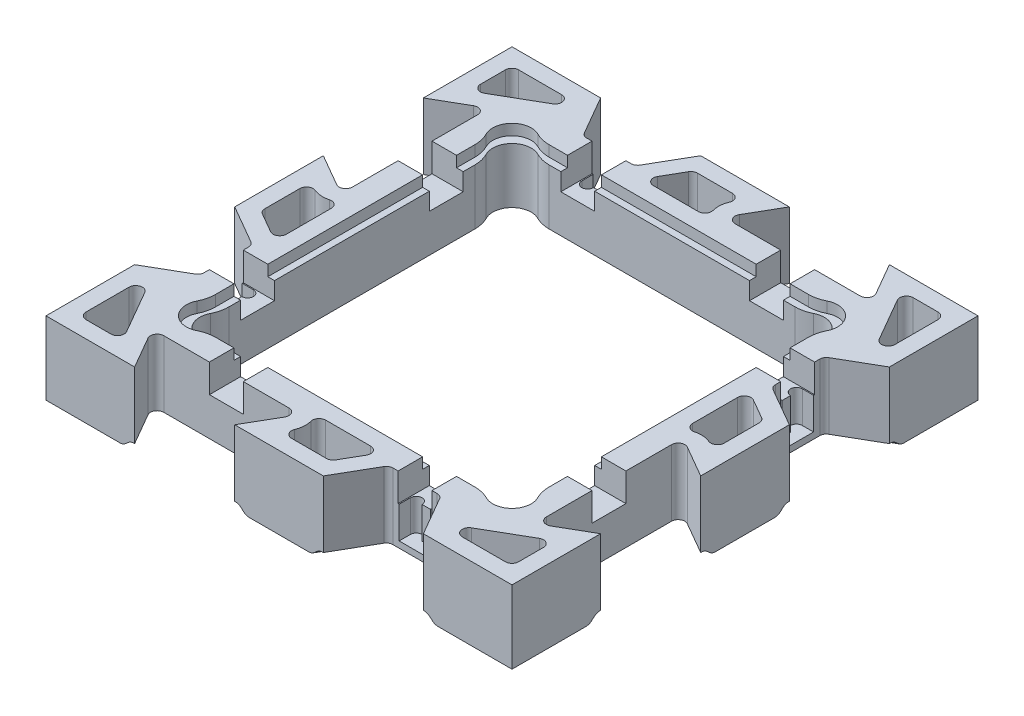
from build123d import *

# Parameters (mm, degrees)
SKETCH1_W                               = 139.7
SKETCH1_H                               = 139.7
BOSS_EXTRUDE1_DEPTH                     = 10.95
POWER_SUPPLY_COMPONENT_DEPTH_DEPTH      = 102.181297679
POWER_SUPPLY_COMPONENT_DEPTH_DEPTH_BACK = 102.181297679
CUT_EXTRUDE6_DEPTH                      = 22.4
SKETCH8_W                               = 10.16
SKETCH8_H                               = 9.35
CUT_EXTRUDE7_DEPTH                      = 8.48
CUT_EXTRUDE8_DEPTH                      = 9.53
FILLET2_R                               = 2
CIRPATTERN5_COUNT                       = 4
FILLET2_OF_CIRPATTERN5_R                = 2
CUT_EXTRUDE9_DEPTH                      = 3.25
FILLET3_R                               = 10
CIRPATTERN6_COUNT                       = 4
FILLET4_R                               = 2
CUT_EXTRUDE10_DEPTH                     = 16.9
FILLET5_R                               = 2
CIRPATTERN7_COUNT                       = 4
FILLET5_OF_CIRPATTERN7_R                = 2


with BuildPart() as part:
    # Sketch1 → Boss-Extrude1 (new, symmetric)
    with BuildSketch(Plane(origin=(0, 0, 0), x_dir=(1, 0, 0), z_dir=(0, 1, 0))):
        Rectangle(SKETCH1_W, SKETCH1_H)
    extrude(amount=BOSS_EXTRUDE1_DEPTH, both=True)

    # Sketch6 → power_supply_component_depth (cut, two sides: drawn at the far end of the back side and taken through both)
    with BuildSketch(Plane(origin=(0, 10.95, 0), x_dir=(1, 0, 0), z_dir=(0, 1, 0)).offset(-POWER_SUPPLY_COMPONENT_DEPTH_DEPTH_BACK)):
        with BuildLine():
            Line((-48, 39.868272016), (-48, -39.868272016))
            ThreePointArc((-48, -39.868272016), (-48, -48), (-39.868272016, -48))
            Line((-39.868272016, -48), (39.868272016, -48))
            ThreePointArc((39.868272016, -48), (48, -48), (48, -39.868272016))
            Line((48, -39.868272016), (48, 39.868272016))
            ThreePointArc((48, 39.868272016), (48, 48), (39.868272016, 48))
            Line((39.868272016, 48), (-39.868272016, 48))
            ThreePointArc((-39.868272016, 48), (-48, 48), (-48, 39.868272016))
        make_face()
    extrude(amount=POWER_SUPPLY_COMPONENT_DEPTH_DEPTH + POWER_SUPPLY_COMPONENT_DEPTH_DEPTH_BACK, mode=Mode.SUBTRACT)

    # Sketch4 → Cut-Extrude6 (cut)
    with BuildSketch(Plane(origin=(0, 10.95, 0), x_dir=(1, 0, 0), z_dir=(0, 1, 0))):
        Polygon((-43.283333333, -69.85), (-50.500211698, -57.35), (-6.066454968, -57.35), (-13.283333333, -69.85), align=None)
        Polygon((43.283333333, -69.85), (36.066454968, -57.35), (20.500211698, -57.35), (13.283333333, -69.85), align=None)
    cut_extrude6 = extrude(amount=-CUT_EXTRUDE6_DEPTH, mode=Mode.SUBTRACT)

    # Sketch8 → Cut-Extrude7 (cut)
    with BuildSketch(Plane(origin=(0, 10.95, 0), x_dir=(1, 0, 0), z_dir=(0, 1, 0))):
        with Locations((-28.283333333, -52.675)):
            Rectangle(SKETCH8_W, SKETCH8_H)
        with Locations((28.283333333, -52.675)):
            Rectangle(SKETCH8_W, SKETCH8_H)
    cut_extrude7 = extrude(amount=-CUT_EXTRUDE7_DEPTH, mode=Mode.SUBTRACT)

    # Sketch9 → Cut-Extrude8 (cut)
    with BuildSketch(Plane(origin=(0, 2.47, 0), x_dir=(1, 0, 0), z_dir=(0, 1, 0))):
        with BuildLine():
            Line((27.018333333, -53.975), (29.548333333, -53.975))
            ThreePointArc((29.548333333, -53.975), (31.298333333, -52.225), (33.048333333, -53.975))
            Line((33.048333333, -53.975), (33.048333333, -57.35))
            Line((33.048333333, -57.35), (23.518333333, -57.35))
            Line((23.518333333, -57.35), (23.518333333, -53.975))
            ThreePointArc((23.518333333, -53.975), (25.268333333, -52.225), (27.018333333, -53.975))
        make_face()
    cut_extrude8 = extrude(amount=-CUT_EXTRUDE8_DEPTH, mode=Mode.SUBTRACT)

    # Fillet2
    fillet2_edges = [part.edges().sort_by_distance(p)[0] for p in [
        (-50.500211698, 0, 57.35),
        (-6.066454968, 0, 57.35),
        (20.500211698, 0, 57.35),
        (36.066454968, 0, 57.35),
    ]]
    fillet(fillet2_edges, radius=FILLET2_R)

    # CirPattern5: Cut-Extrude6, Cut-Extrude7, Cut-Extrude8 ×4 about axis
    cirpattern5_axis = Axis((0, 0, 0), (0, 1, 0))
    add([cut_extrude6.rotate(cirpattern5_axis, i * 360 / CIRPATTERN5_COUNT) for i in range(1, CIRPATTERN5_COUNT)], mode=Mode.SUBTRACT)
    add([cut_extrude7.rotate(cirpattern5_axis, i * 360 / CIRPATTERN5_COUNT) for i in range(1, CIRPATTERN5_COUNT)], mode=Mode.SUBTRACT)
    add([cut_extrude8.rotate(cirpattern5_axis, i * 360 / CIRPATTERN5_COUNT) for i in range(1, CIRPATTERN5_COUNT)], mode=Mode.SUBTRACT)

    # Fillet2 of CirPattern5
    fillet2_of_cirpattern5_edges = [part.edges().sort_by_distance(p)[0] for p in [
        (57.35, 0, 50.500211698),
        (57.35, 0, 6.066454968),
        (57.35, 0, -20.500211698),
        (57.35, 0, -36.066454968),
        (50.500211698, 0, -57.35),
        (6.066454968, 0, -57.35),
        (-20.500211698, 0, -57.35),
        (-36.066454968, 0, -57.35),
        (-57.35, 0, -50.500211698),
        (-57.35, 0, -6.066454968),
        (-57.35, 0, 20.500211698),
        (-57.35, 0, 36.066454968),
    ]]
    fillet(fillet2_of_cirpattern5_edges, radius=FILLET2_OF_CIRPATTERN5_R)

    # Sketch10 → Cut-Extrude9 (cut)
    with BuildSketch(Plane(origin=(0, 10.95, 0), x_dir=(1, 0, 0), z_dir=(0, 1, 0))):
        with BuildLine():
            Line((-41.868272016, 50), (41.868272016, 50))
            ThreePointArc((41.868272016, 50), (50, 50), (50, 41.868272016))
            Line((50, 41.868272016), (50, -41.868272016))
            ThreePointArc((50, -41.868272016), (50, -50), (41.868272016, -50))
            Line((41.868272016, -50), (-41.868272016, -50))
            ThreePointArc((-41.868272016, -50), (-50, -50), (-50, -41.868272016))
            Line((-50, -41.868272016), (-50, 41.868272016))
            ThreePointArc((-50, 41.868272016), (-50, 50), (-41.868272016, 50))
        make_face()
    extrude(amount=-CUT_EXTRUDE9_DEPTH, mode=Mode.SUBTRACT)

    # Fillet3
    fillet3_edges = [part.edges().sort_by_distance(p)[0] for p in [
        (-48, -1.625, -39.868272016),
        (-39.868272016, -1.625, -48),
        (39.868272016, -1.625, -48),
        (48, -1.625, -39.868272016),
        (48, -1.625, 39.868272016),
        (39.868272016, -1.625, 48),
        (-39.868272016, -1.625, 48),
        (-48, -1.625, 39.868272016),
        (41.868272016, 9.325, 50),
        (-50, 9.325, 41.868272016),
        (-41.868272016, 9.325, -50),
        (50, 9.325, -41.868272016),
        (41.868272016, 9.325, -50),
        (50, 9.325, 41.868272016),
        (-41.868272016, 9.325, 50),
        (-50, 9.325, -41.868272016),
    ]]
    fillet(fillet3_edges, radius=FILLET3_R)

    # Cut-Sweep1: sweep along a path in Sketch12
    with BuildLine(Plane.XZ.offset(10.95)) as cut_sweep1_path:
        Line((-13.283333333, 69.85), (-7.798505776, 60.35))
        ThreePointArc((-7.798505776, 60.35), (-7.798505776, 58.35), (-9.530556584, 57.35))
        Line((-9.530556584, 57.35), (-47.036110083, 57.35))
        ThreePointArc((-47.036110083, 57.35), (-48.768160891, 58.35), (-48.768160891, 60.35))
        Line((-48.768160891, 60.35), (-43.283333333, 69.85))
    # Sketch11 → Cut-Sweep1 (sweep, cut)
    with BuildSketch(Plane(origin=(19.425103894, 0, 33.645266886), x_dir=(-0.8660254037844362, 0, 0.5000000000000044), z_dir=(-0.5000000000000044, 0, -0.8660254037844362))):
        Polygon((72.409466227, -10.95), (75.409466227, -10.95), (73.409466227, -8.95), (72.409466227, -8.95), align=None)
    cut_sweep1 = sweep(path=cut_sweep1_path.line, mode=Mode.SUBTRACT)

    # Cut-Sweep2: sweep along a path in Sketch14
    with BuildLine(Plane.XZ.offset(10.95)) as cut_sweep2_path:
        Line((7.509830641, 79.85), (13.283333333, 69.85))
        Line((13.283333333, 69.85), (19.922861429, 58.35))
        ThreePointArc((19.922861429, 58.35), (20.654912237, 57.617949192), (21.654912237, 57.35))
        Line((21.654912237, 57.35), (34.91175443, 57.35))
        ThreePointArc((34.91175443, 57.35), (35.91175443, 57.617949192), (36.643805238, 58.35))
        Line((36.643805238, 58.35), (43.283333333, 69.85))
        Line((43.283333333, 69.85), (49.056836025, 79.85))
    # Sketch13 → Cut-Sweep2 (sweep, cut)
    with BuildSketch(Plane(origin=(-26.925103894, 0, 46.635647943), x_dir=(-0.8660254037844395, 0, -0.49999999999999867), z_dir=(0.49999999999999867, 0, -0.8660254037844395))):
        Polygon((-46.428704114, -10.95), (-43.428704114, -10.95), (-45.428704114, -8.95), (-46.428704114, -8.95), align=None)
    cut_sweep2 = sweep(path=cut_sweep2_path.line, mode=Mode.SUBTRACT)

    # CirPattern6: Cut-Sweep1, Cut-Sweep2 ×4 about axis
    cirpattern6_axis = Axis((0, 0, 0), (0, 1, 0))
    add([cut_sweep1.rotate(cirpattern6_axis, i * 360 / CIRPATTERN6_COUNT) for i in range(1, CIRPATTERN6_COUNT)], mode=Mode.SUBTRACT)
    add([cut_sweep2.rotate(cirpattern6_axis, i * 360 / CIRPATTERN6_COUNT) for i in range(1, CIRPATTERN6_COUNT)], mode=Mode.SUBTRACT)

    # Cut-Sweep3: sweep along a path in Sketch16
    with BuildLine(Plane.XZ.offset(10.95)) as cut_sweep3_path:
        Line((48, 36.847954373), (48, -36.847954373))
        ThreePointArc((48, -36.847954373), (48.270995093, -39.160196471), (49.069292704, -41.347117316))
        ThreePointArc((49.069292704, -41.347117316), (48, -48), (41.347117316, -49.069292704))
        ThreePointArc((41.347117316, -49.069292704), (39.160196471, -48.270995093), (36.847954373, -48))
        Line((36.847954373, -48), (-36.847954373, -48))
        ThreePointArc((-36.847954373, -48), (-39.160196471, -48.270995093), (-41.347117316, -49.069292704))
        ThreePointArc((-41.347117316, -49.069292704), (-48, -48), (-49.069292704, -41.347117316))
        ThreePointArc((-49.069292704, -41.347117316), (-48.270995093, -39.160196471), (-48, -36.847954373))
        Line((-48, -36.847954373), (-48, 36.847954373))
        ThreePointArc((-48, 36.847954373), (-48.270995093, 39.160196471), (-49.069292704, 41.347117316))
        ThreePointArc((-49.069292704, 41.347117316), (-48, 48), (-41.347117316, 49.069292704))
        ThreePointArc((-41.347117316, 49.069292704), (-39.160196471, 48.270995093), (-36.847954373, 48))
        Line((-36.847954373, 48), (36.847954373, 48))
        ThreePointArc((36.847954373, 48), (39.160196471, 48.270995093), (41.347117316, 49.069292704))
        ThreePointArc((41.347117316, 49.069292704), (48, 48), (49.069292704, 41.347117316))
        ThreePointArc((49.069292704, 41.347117316), (48.270995093, 39.160196471), (48, 36.847954373))
    # Sketch15 → Cut-Sweep3 (sweep, cut)
    with BuildSketch(Plane.XY):
        Polygon((-48, -10.95), (-51, -10.95), (-49, -8.95), (-48, -8.95), align=None)
    sweep(path=cut_sweep3_path.line, mode=Mode.SUBTRACT)

    # Fillet4
    fillet4_edges = [part.edges().sort_by_distance(p)[0] for p in [
        (-63.85, -8.95, 15.59273441),
        (-63.35, -10.95, 42.994658199),
        (-63.85, -8.95, 40.973932257),
        (-63.35, -10.95, 13.572008468),
        (-55.019872981, -10.95, 19.154912237),
        (-56.751923789, -8.95, 20.154912237),
        (-54.35, -10.95, 28.283333333),
        (-56.35, -8.95, 28.283333333),
        (-55.019872981, -10.95, 37.41175443),
        (-56.751923789, -8.95, 36.41175443),
        (-63.35, -10.95, 42.994658199),
        (-63.85, -8.95, 40.973932257),
        (-49, -8.95, 0),
        (-49.243895584, -8.95, -38.928972261),
        (-51.189696565, -10.95, -38.466523842),
        (-48.707106781, -8.95, -48.707106781),
        (-50.121320344, -10.95, -50.121320344),
        (-38.928972261, -8.95, -49.243895584),
        (-38.466523842, -10.95, -51.189696565),
        (0, -8.95, -49),
        (0, -10.95, -51),
        (38.928972261, -8.95, -49.243895584),
        (38.466523842, -10.95, -51.189696565),
        (48.707106781, -8.95, -48.707106781),
        (50.121320344, -10.95, -50.121320344),
        (49.243895584, -8.95, -38.928972261),
        (51.189696565, -10.95, -38.466523842),
        (49, -8.95, 0),
        (51, -10.95, 0),
        (49.243895584, -8.95, 38.928972261),
        (51.189696565, -10.95, 38.466523842),
        (48.707106781, -8.95, 48.707106781),
        (50.121320344, -10.95, 50.121320344),
        (38.928972261, -8.95, 49.243895584),
        (38.466523842, -10.95, 51.189696565),
        (0, -8.95, 49),
        (0, -10.95, 51),
        (-38.928972261, -8.95, 49.243895584),
        (-38.466523842, -10.95, 51.189696565),
        (-48.707106781, -8.95, 48.707106781),
        (-50.121320344, -10.95, 50.121320344),
        (-49.243895584, -8.95, 38.928972261),
        (-51.189696565, -10.95, 38.466523842),
        (-49, -8.95, 0),
        (-51, -10.95, 0),
        (-51, -10.95, 0),
        (-49.056836025, -10.95, 65.85),
        (-47.036110083, -8.95, 65.35),
        (-51.366237102, -10.95, 56.85),
        (-49.634186294, -8.95, 57.85),
        (-28.283333333, -10.95, 54.35),
        (-28.283333333, -8.95, 56.35),
        (-5.200429565, -10.95, 56.85),
        (-6.932480372, -8.95, 57.85),
        (-7.509830641, -10.95, 65.85),
        (-9.530556584, -8.95, 65.35),
        (42.994658199, -10.95, 63.35),
        (40.973932257, -8.95, 63.85),
        (13.572008468, -10.95, 63.35),
        (15.59273441, -8.95, 63.85),
        (42.994658199, -10.95, 63.35),
        (40.973932257, -8.95, 63.85),
        (37.41175443, -10.95, 55.019872981),
        (36.41175443, -8.95, 56.751923789),
        (28.283333333, -10.95, 54.35),
        (28.283333333, -8.95, 56.35),
        (19.154912237, -10.95, 55.019872981),
        (20.154912237, -8.95, 56.751923789),
        (65.85, -10.95, 49.056836025),
        (65.35, -8.95, 47.036110083),
        (56.85, -10.95, 51.366237102),
        (57.85, -8.95, 49.634186294),
        (54.35, -10.95, 28.283333333),
        (56.35, -8.95, 28.283333333),
        (56.85, -10.95, 5.200429565),
        (57.85, -8.95, 6.932480372),
        (65.85, -10.95, 7.509830641),
        (65.35, -8.95, 9.530556584),
        (49.056836025, -10.95, -65.85),
        (47.036110083, -8.95, -65.35),
        (51.366237102, -10.95, -56.85),
        (49.634186294, -8.95, -57.85),
        (28.283333333, -10.95, -54.35),
        (28.283333333, -8.95, -56.35),
        (5.200429565, -10.95, -56.85),
        (6.932480372, -8.95, -57.85),
        (7.509830641, -10.95, -65.85),
        (9.530556584, -8.95, -65.35),
        (-65.85, -10.95, -49.056836025),
        (-65.35, -8.95, -47.036110083),
        (-56.85, -10.95, -51.366237102),
        (-57.85, -8.95, -49.634186294),
        (-54.35, -10.95, -28.283333333),
        (-56.35, -8.95, -28.283333333),
        (-56.85, -10.95, -5.200429565),
        (-57.85, -8.95, -6.932480372),
        (-65.85, -10.95, -7.509830641),
        (-65.35, -8.95, -9.530556584),
        (63.85, -8.95, -15.59273441),
        (63.35, -10.95, -42.994658199),
        (63.85, -8.95, -40.973932257),
        (63.35, -10.95, -13.572008468),
        (55.019872981, -10.95, -19.154912237),
        (56.751923789, -8.95, -20.154912237),
        (54.35, -10.95, -28.283333333),
        (56.35, -8.95, -28.283333333),
        (55.019872981, -10.95, -37.41175443),
        (56.751923789, -8.95, -36.41175443),
        (63.35, -10.95, -42.994658199),
        (63.85, -8.95, -40.973932257),
        (-13.572008468, -10.95, -63.35),
        (-42.994658199, -10.95, -63.35),
        (-40.973932257, -8.95, -63.85),
        (-15.59273441, -8.95, -63.85),
        (-42.994658199, -10.95, -63.35),
        (-40.973932257, -8.95, -63.85),
        (-37.41175443, -10.95, -55.019872981),
        (-36.41175443, -8.95, -56.751923789),
        (-28.283333333, -10.95, -54.35),
        (-28.283333333, -8.95, -56.35),
        (-19.154912237, -10.95, -55.019872981),
        (-20.154912237, -8.95, -56.751923789),
    ]]
    fillet(fillet4_edges, radius=FILLET4_R)

    # Sketch17 → Cut-Extrude10 (cut)
    with BuildSketch(Plane(origin=(0, 10.95, 0), x_dir=(1, 0, 0), z_dir=(0, 1, 0))):
        with BuildLine():
            Line((62.85, 64.85), (55.407688986, 64.85))
            ThreePointArc((55.407688986, 64.85), (53.675638179, 63.85), (53.675638179, 61.85))
            Line((53.675638179, 61.85), (61.117949192, 48.959539199))
            ThreePointArc((61.117949192, 48.959539199), (63.36763809, 48.027687546), (64.85, 49.959539199))
            Line((64.85, 49.959539199), (64.85, 62.85))
            ThreePointArc((64.85, 62.85), (64.264213562, 64.264213562), (62.85, 64.85))
        make_face()
        with BuildLine():
            Line((64.85, 10.396581987), (55, 16.083482139))
            Line((55, 16.083482139), (55, -4.046260822))
            ThreePointArc((55, -4.046260822), (58.836081796, -2.54944721), (62.85, -3.468378757))
            Line((62.85, -3.468378757), (64.85, -4.623079295))
            Line((64.85, -4.623079295), (64.85, 10.396581987))
        make_face()
    cut_extrude10 = extrude(amount=-CUT_EXTRUDE10_DEPTH, mode=Mode.SUBTRACT)

    # Fillet5
    fillet5_edges = [part.edges().sort_by_distance(p)[0] for p in [
        (64.85, 2.5, 4.623079295),
        (64.85, 2.5, -10.396581987),
        (55, 2.5, -16.083482139),
        (55, 2.5, 4.046260822),
    ]]
    fillet(fillet5_edges, radius=FILLET5_R)

    # CirPattern7: Cut-Extrude10 ×4 about axis
    cirpattern7_axis = Axis((0, 0, 0), (0, 1, 0))
    for i in range(1, CIRPATTERN7_COUNT):
        add(cut_extrude10.rotate(cirpattern7_axis, i * 360 / CIRPATTERN7_COUNT), mode=Mode.SUBTRACT)

    # Fillet5 of CirPattern7
    fillet5_of_cirpattern7_edges = [part.edges().sort_by_distance(p)[0] for p in [
        (4.623079295, 2.5, -64.85),
        (-10.396581987, 2.5, -64.85),
        (-16.083482139, 2.5, -55),
        (4.046260822, 2.5, -55),
        (-64.85, 2.5, -4.623079295),
        (-64.85, 2.5, 10.396581987),
        (-55, 2.5, 16.083482139),
        (-55, 2.5, -4.046260822),
        (-4.623079295, 2.5, 64.85),
        (10.396581987, 2.5, 64.85),
        (16.083482139, 2.5, 55),
        (-4.046260822, 2.5, 55),
    ]]
    fillet(fillet5_of_cirpattern7_edges, radius=FILLET5_OF_CIRPATTERN7_R)


solid = part.part
